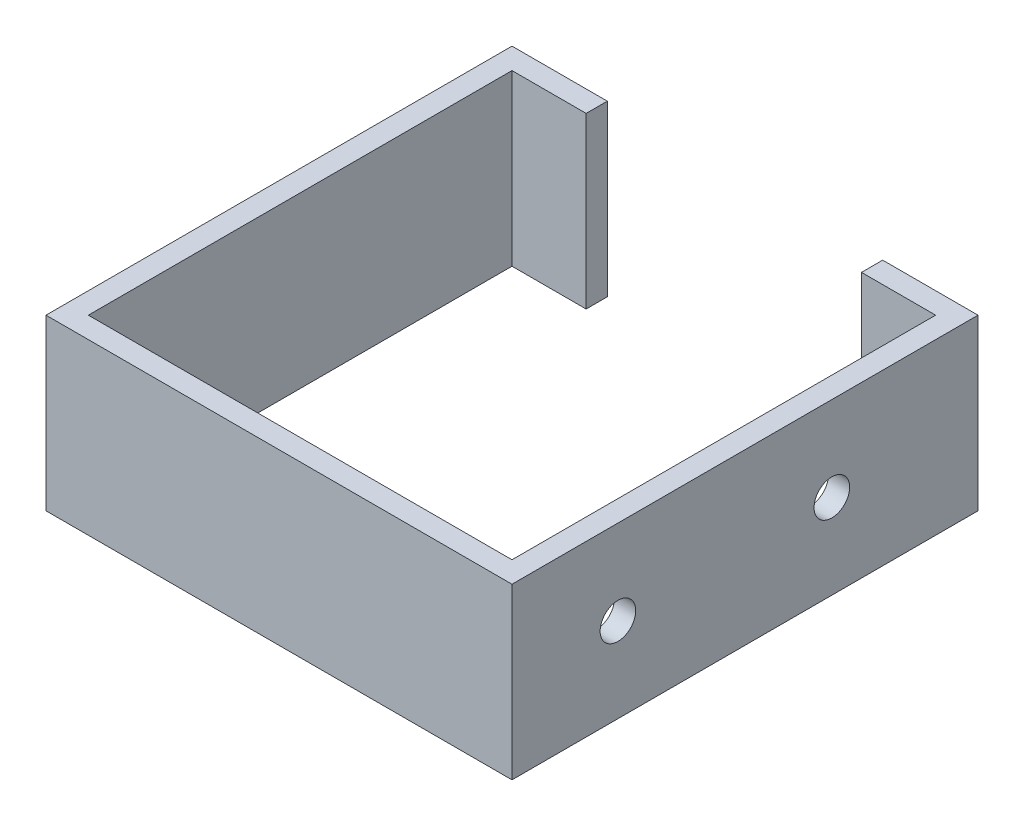
from build123d import *

# Parameters (mm, degrees)
BOSS_EXTRUDE1_DEPTH = 25.4
CUT_EXTRUDE1_REACH  = 101.849
SKETCH2_R           = 2.667


with BuildPart() as part:
    # Sketch1 → Boss-Extrude1 (new body)
    with BuildSketch(Plane(origin=(0, 0, 0), x_dir=(1, 0, 0), z_dir=(0, 1, 0))):
        Polygon((-3.175, -3.175), (-3.175, 63.5), (-3.175, 66.675), (11.1125, 66.675), (11.1125, 63.5), (0, 63.5), (0, 0), (63.5, 0), (63.5, 63.5), (52.3875, 63.5), (52.3875, 66.675), (66.675, 66.675), (66.675, 63.5), (66.675, -3.175), align=None)
    extrude(amount=BOSS_EXTRUDE1_DEPTH)

    # Sketch2 → Cut-Extrude1 (cut, up to next)
    with BuildSketch(Plane(origin=(66.675, 0, 0), x_dir=(0, 0, -1), z_dir=(1, 0, 0)), mode=Mode.PRIVATE) as cut_extrude1_sk1:
        with Locations((12.7, 12.7)):
            Circle(SKETCH2_R)
    cut_extrude1_tool1 = extrude(cut_extrude1_sk1.sketch, amount=-CUT_EXTRUDE1_REACH, mode=Mode.PRIVATE) & part.part
    # Sketch2 → Cut-Extrude1 (cut, up to next)
    with BuildSketch(Plane(origin=(66.675, 0, 0), x_dir=(0, 0, -1), z_dir=(1, 0, 0)), mode=Mode.PRIVATE) as cut_extrude1_sk2:
        with Locations((44.7675, 12.7)):
            Circle(SKETCH2_R)
    cut_extrude1_tool2 = extrude(cut_extrude1_sk2.sketch, amount=-CUT_EXTRUDE1_REACH, mode=Mode.PRIVATE) & part.part
    add(cut_extrude1_tool1.solids().sort_by_distance((66.675, 12.7, -12.7))[0], mode=Mode.SUBTRACT)
    add(cut_extrude1_tool2.solids().sort_by_distance((66.675, 12.7, -44.7675))[0], mode=Mode.SUBTRACT)


solid = part.part
